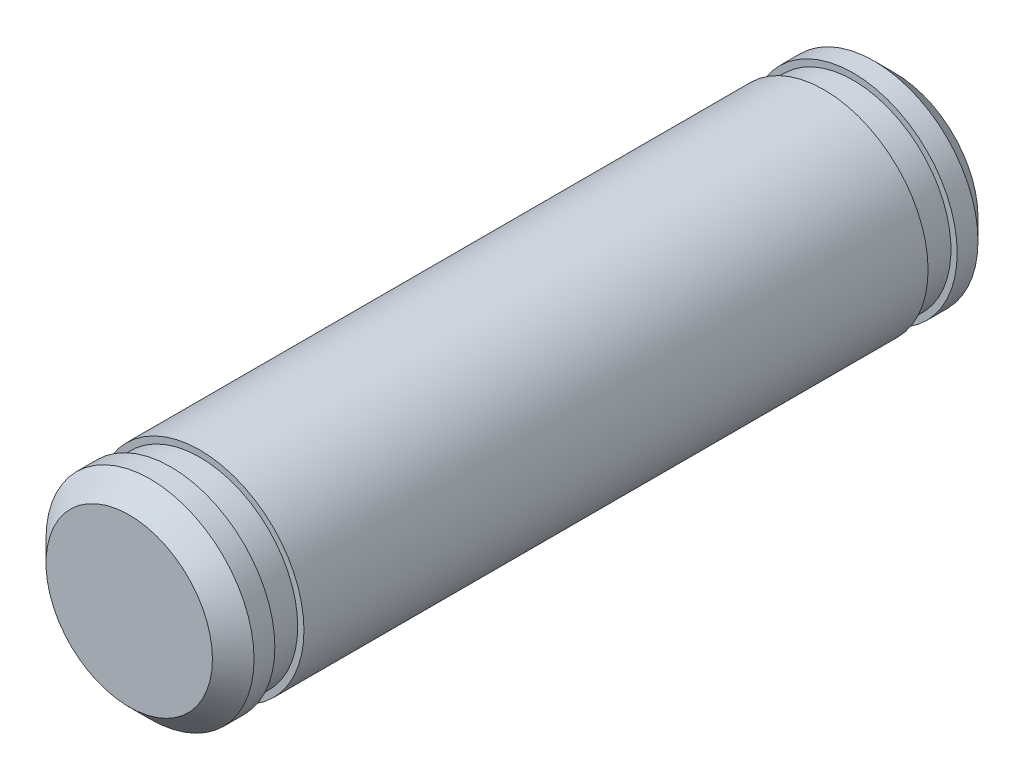
from build123d import *

# Parameters (mm, degrees)
SZKIC1_R                    = 2.5
DODANIE_WYCI_GNI_CIE1_DEPTH = 18.4
SFAZOWANIE1_SIZE            = 0.5
WYTNIJ_WYCI_GNI_CIE1_START  = -1.7
SZKIC2_R                    = 2.5
SZKIC2_R_2                  = 2.35
WYTNIJ_WYCI_GNI_CIE1_DEPTH  = 0.7
WYTNIJ_WYCI_GNI_CIE2_START  = -1
SZKIC3_R                    = 2.5
SZKIC3_R_2                  = 2.35
WYTNIJ_WYCI_GNI_CIE2_DEPTH  = 0.7


with BuildPart() as part:
    # Szkic1 → Dodanie-wyciągnięcie1 (new body)
    with BuildSketch(Plane.XY):
        Circle(SZKIC1_R)
    extrude(amount=DODANIE_WYCI_GNI_CIE1_DEPTH)

    # Sfazowanie1
    sfazowanie1_edges = [part.edges().sort_by_distance(p)[0] for p in [
        (-2.5, 0, 0),
        (-2.5, 0, 18.4),
    ]]
    chamfer(sfazowanie1_edges, length=SFAZOWANIE1_SIZE)

    # Szkic2 → Wytnij-wyciągnięcie1 (cut)
    with BuildSketch(Plane.XY.offset(18.4).offset(WYTNIJ_WYCI_GNI_CIE1_START)):
        Circle(SZKIC2_R)
        Circle(SZKIC2_R_2, mode=Mode.SUBTRACT)
    extrude(amount=WYTNIJ_WYCI_GNI_CIE1_DEPTH, mode=Mode.SUBTRACT)

    # Szkic3 → Wytnij-wyciągnięcie2 (cut)
    with BuildSketch(Plane(origin=(0, 0, 0), x_dir=(-1, 0, 0), z_dir=(0, 0, -1)).offset(WYTNIJ_WYCI_GNI_CIE2_START)):
        Circle(SZKIC3_R)
        Circle(SZKIC3_R_2, mode=Mode.SUBTRACT)
    extrude(amount=-WYTNIJ_WYCI_GNI_CIE2_DEPTH, mode=Mode.SUBTRACT)


solid = part.part
